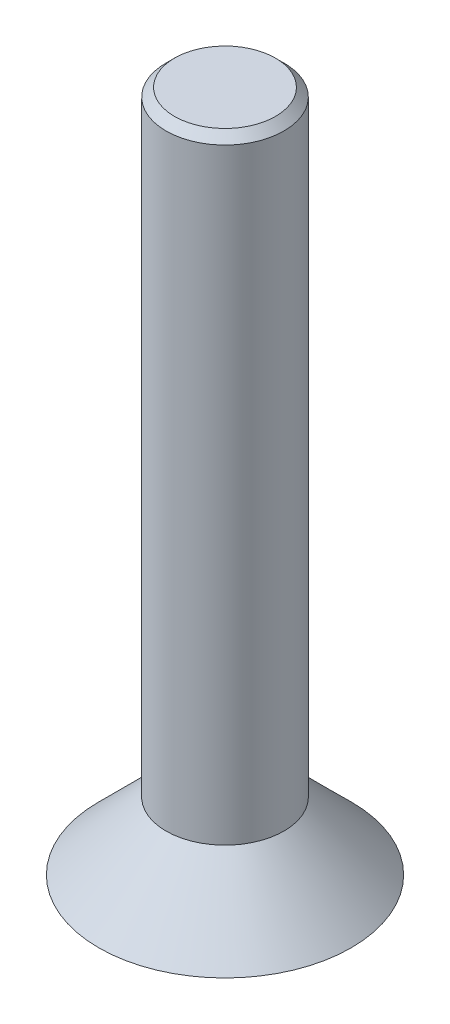
from build123d import *

# Parameters (mm, degrees)
SKETCH_1_R      = 3
EXTRUDE_1_DEPTH = 1.6
CHAMFER_1_SIZE  = 1.6
SKETCH_2_R      = 1.4
EXTRUDE_2_DEPTH = 14.6
CHAMFER_2_SIZE  = 0.2


with BuildPart() as part:
    # 草图1 → 凸台-拉伸1 (new body)
    with BuildSketch(Plane(origin=(0, 0, 0), x_dir=(1, 0, 0), z_dir=(0, 1, 0))):
        with Locations(Location((0, 0, 0), (0, 0, 270))):
            Circle(SKETCH_1_R)
        Polygon((0, -1.154700538), (1, -0.577350269), (1, 0.577350269), (0, 1.154700538), (-1, 0.577350269), (-1, -0.577350269), align=None, mode=Mode.SUBTRACT)
    extrude(amount=EXTRUDE_1_DEPTH)

    # 倒角1
    # the kernel refuses this chamfer: 1.6 mm, written as the material it takes off along each edge
    with BuildSketch(Plane(origin=(0, 1.6, 0), x_dir=(0, 0, 1), z_dir=(-1, 0, 0))) as chamfer_1_piece_1:
        Polygon((3, -CHAMFER_1_SIZE), (3 - CHAMFER_1_SIZE, 0), (3, 0), align=None)
    revolve(axis=Axis((0, 1.6, 0), (0, 1, 0)), mode=Mode.SUBTRACT)

    # 草图2 → 凸台-拉伸2 (add)
    with BuildSketch(Plane(origin=(0, 1.6, 0), x_dir=(1, 0, 0), z_dir=(0, 1, 0))):
        with Locations(Location((0, 0, 0), (0, 0, 270))):
            Circle(SKETCH_2_R)
    extrude(amount=EXTRUDE_2_DEPTH)

    # 倒角2
    chamfer_2_edges = [part.edges().sort_by_distance(p)[0] for p in [
        (0, 16.2, -1.4),
    ]]
    chamfer(chamfer_2_edges, length=CHAMFER_2_SIZE)


solid = part.part
